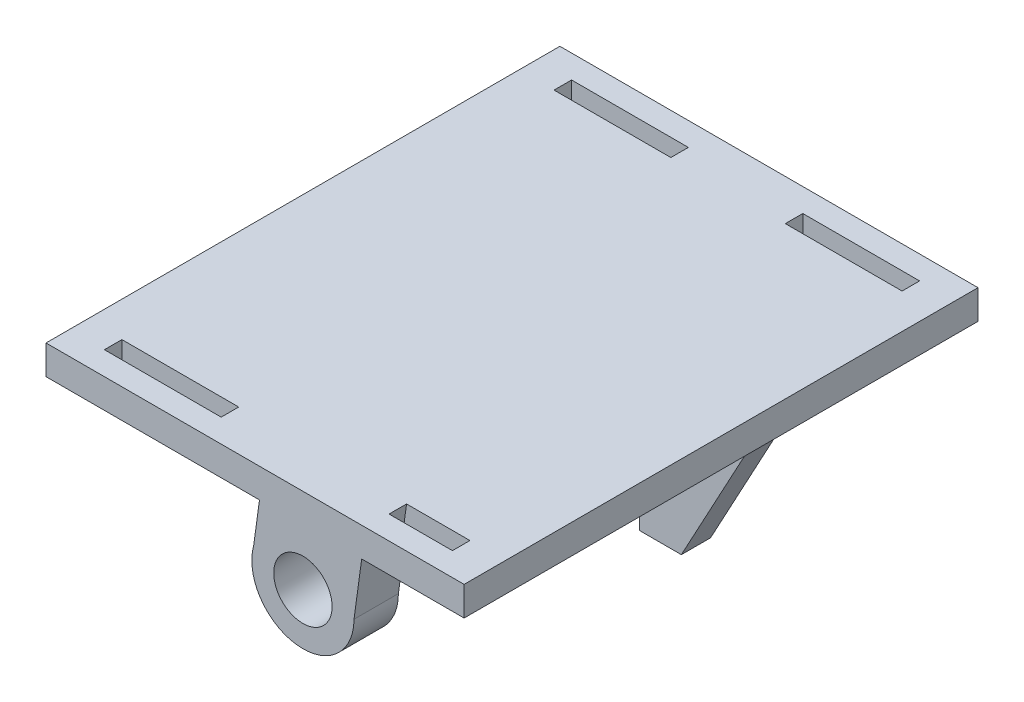
from build123d import *

# Parameters (mm, degrees)
SKETCH1_W               = 45.466
SKETCH1_H               = 55.88
SKETCH1_W_2             = 12.7
SKETCH1_H_2             = 1.905
BOSS_EXTRUDE1_DEPTH     = 3.175
BOSS_EXTRUDE2_DEPTH     = 3.175
BOSS_EXTRUDE3_START     = -4.826
BOSS_EXTRUDE3_OUTLINE_R = 3.175
BOSS_EXTRUDE3_DEPTH     = 4.826


# Read off the part's stored shape, not the designer's step: Boss-Extrude3
with BuildPart() as part:
    # Sketch1 → Boss-Extrude1 (new body)
    with BuildSketch(Plane(origin=(0, 0, 0), x_dir=(1, 0, 0), z_dir=(0, 1, 0))):
        with Locations((22.733, 27.94)):
            Rectangle(SKETCH1_W, SKETCH1_H)
        with Locations((35.306, 52.3875)):
            Rectangle(SKETCH1_W_2, SKETCH1_H_2, mode=Mode.SUBTRACT)
        with Locations((10.16, 52.3875)):
            Rectangle(SKETCH1_W_2, SKETCH1_H_2, mode=Mode.SUBTRACT)
        with Locations((35.306, 3.4925)):
            Rectangle(SKETCH1_W_2, SKETCH1_H_2, mode=Mode.SUBTRACT)
        with Locations((10.16, 3.4925)):
            Rectangle(SKETCH1_W_2, SKETCH1_H_2, mode=Mode.SUBTRACT)
    extrude(amount=BOSS_EXTRUDE1_DEPTH)

    # 3DSketch2 → Boss-Extrude2 (add)
    with BuildSketch(Plane(origin=(34.036, 0, -30.48), x_dir=(-1, 0, 0), z_dir=(0, 0, 1))):
        Polygon((0, 0), (0, 12.7), (-4.572, 12.7), (-11.43, 0), align=None)
        Polygon((22.606, 0), (22.606, 12.7), (27.178, 12.7), (34.036, 0), align=None)
    extrude(amount=-BOSS_EXTRUDE2_DEPTH)

    # Boss-Extrude3 outline → Boss-Extrude3 (add)
    with BuildSketch(Plane.XY.offset(BOSS_EXTRUDE3_START)):
        with BuildLine():
            Line((23.215006065, 0), (22.584264524, -4.606399832))
            ThreePointArc((22.584264524, -4.606399832), (27.182231525, -11.604883936), (33.49225, -6.1))
            Line((33.49225, -6.1), (34.76225, 3.175))
            Line((34.76225, 3.175), (28.956, 3.175))
            Line((28.956, 3.175), (28.956, 0))
            Line((28.956, 0), (23.215006065, 0))
        make_face()
        with Locations((27.936, -6.1)):
            Circle(BOSS_EXTRUDE3_OUTLINE_R, mode=Mode.SUBTRACT)
    extrude(amount=BOSS_EXTRUDE3_DEPTH)


solid = part.part
